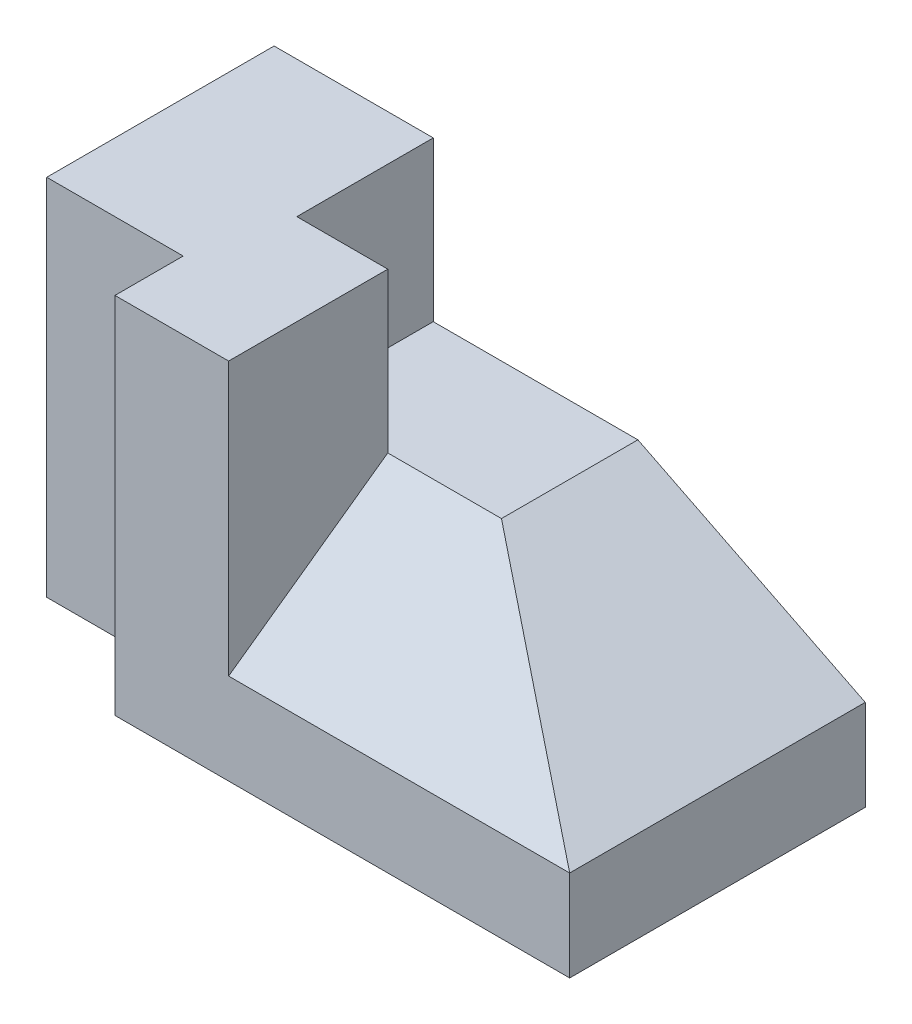
from build123d import *

# Parameters (mm, degrees)
BOSS_EXTRUDE2_DEPTH = 65
SKETCH4_W           = 20
SKETCH4_H           = 30
CUT_EXTRUDE1_DEPTH  = 35
SKETCH5_W           = 50
SKETCH5_H           = 80
BOSS_EXTRUDE3_DEPTH = 30
SKETCH6_W           = 30
SKETCH6_H           = 25
CUT_EXTRUDE2_DEPTH  = 20
LOFT3_START         = -65
LOFT3_DEPTH         = 65
LOFT3_START_2       = 25
LOFT3_2_DEPTH       = 76


with BuildPart() as part:
    # Sketch3 → Boss-Extrude2 (new body)
    with BuildSketch(Plane.XY):
        Polygon((0, 0), (100, 0), (100, 20), (25, 20), (25, 80), (0, 80), align=None)
    extrude(amount=-BOSS_EXTRUDE2_DEPTH)

    # Sketch4 → Cut-Extrude1 (cut)
    with BuildSketch(Plane(origin=(0, 80, 0), x_dir=(1, 0, 0), z_dir=(0, 1, 0))):
        with Locations((15, 50)):
            Rectangle(SKETCH4_W, SKETCH4_H)
    extrude(amount=-CUT_EXTRUDE1_DEPTH, mode=Mode.SUBTRACT)

    # Sketch5 → Boss-Extrude3 (add)
    with BuildSketch(Plane.ZY):
        with Locations((-40, 40)):
            Rectangle(SKETCH5_W, SKETCH5_H)
    extrude(amount=BOSS_EXTRUDE3_DEPTH)

    # Sketch6 → Cut-Extrude2 (cut)
    with BuildSketch(Plane(origin=(25, 0, 0), x_dir=(0, 0, -1), z_dir=(1, 0, 0))):
        with Locations((50, 32.5)):
            Rectangle(SKETCH6_W, SKETCH6_H)
    extrude(amount=-CUT_EXTRUDE2_DEPTH, mode=Mode.SUBTRACT)

    # Loft3: read off the stored shape, not the designer's step
    # Loft3 outline → Loft3 (add)
    with BuildSketch(Plane.XY.offset(LOFT3_START)):
        Polygon((5, 45), (5, 20), (100, 20), (50, 45), align=None)
    extrude(amount=LOFT3_DEPTH)

    # Loft3 2 outline → Loft3 2 (cut)
    with BuildSketch(Plane.YZ.offset(LOFT3_START_2)):
        Polygon((20, 0), (45, -35), (45, 0), align=None)
    extrude(amount=LOFT3_2_DEPTH, mode=Mode.SUBTRACT)


solid = part.part
